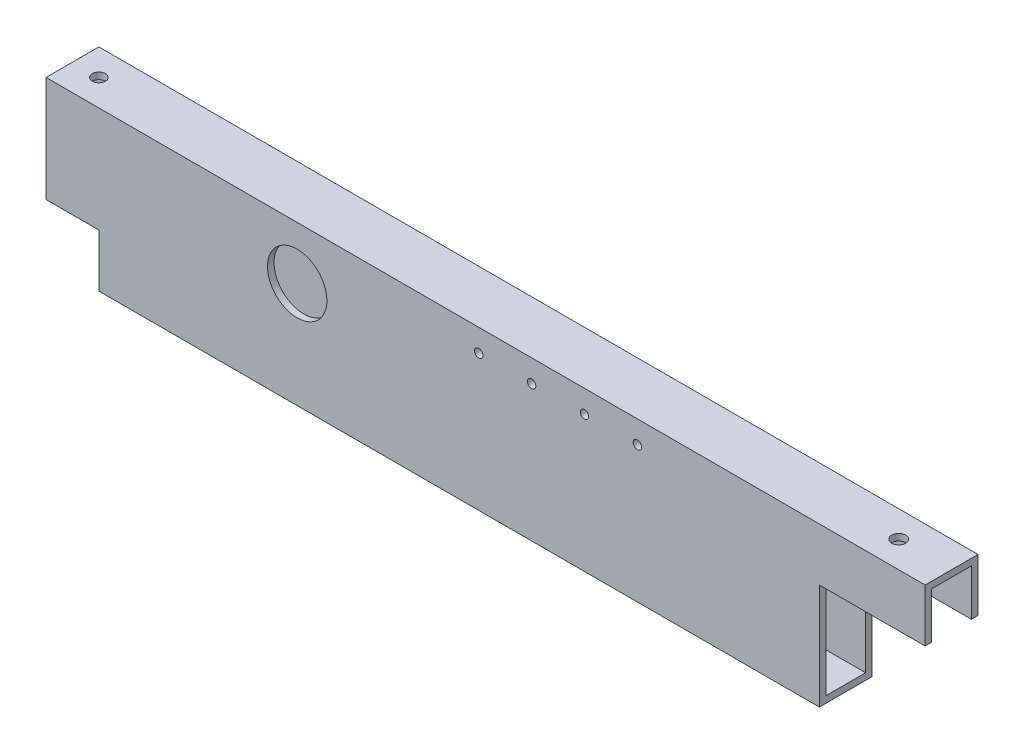
from build123d import *

# Parameters (mm, degrees)
BOSS_EXTRUDE1_DEPTH         = 12.7
F_1_4_0_25_DIAMETER_HOLE1_D = 6.35
CUT_EXTRUDE1_DEPTH          = 580.243923145
SKETCH8_R                   = 14.2875
CUT_EXTRUDE2_DEPTH          = 293.531067795
F_10_32_TAPPED_HOLE1_D      = 4.0386
F_10_32_TAPPED_HOLE1_DEPTH  = 13.716
F_10_32_TAPPED_HOLE1_TIP    = 1.213317848
SKETCH11_W                  = 155.575
SKETCH11_H                  = 76.2
CUT_EXTRUDE3_DEPTH          = 293.531067795
SKETCH13_W                  = 50.8
SKETCH13_H                  = 50.8
CUT_EXTRUDE5_DEPTH          = 293.531067795
F_1_4_CLEARANCE_HOLE1_D     = 6.7564


with BuildPart() as part:
    # Sketch1 → Boss-Extrude1 (new, symmetric)
    with BuildSketch(Plane.XY):
        Polygon((-288.925, 38.1), (-288.925, -12.7), (-263.525, -12.7), (-263.525, -38.1), (263.525, -38.1), (263.525, -12.7), (288.925, -12.7), (288.925, 38.1), align=None)
    extrude(amount=BOSS_EXTRUDE1_DEPTH, both=True)

    # 1/4 (0.25) Diameter Hole1 (through all)
    with Locations(Plane(origin=(0, 38.1, 0), x_dir=(1, 0, 0), z_dir=(0, 1, 0))):
        with Locations((-276.225, 0), (276.225, 0)):
            Hole(F_1_4_0_25_DIAMETER_HOLE1_D / 2)

    # Sketch5 → Cut-Extrude1 (cut, through all)
    with BuildSketch(Plane(origin=(288.925, 0, 0), x_dir=(0, 0, -1), z_dir=(1, 0, 0))):
        Polygon((9.525, -12.7), (9.525, 34.925), (-9.525, 34.925), (-9.525, -12.7), (-9.525, -34.925), (9.525, -34.925), align=None)
    extrude(amount=-CUT_EXTRUDE1_DEPTH, mode=Mode.SUBTRACT)

    # Sketch8 → Cut-Extrude2 (cut, through all)
    with BuildSketch(Plane.XY.offset(12.7)):
        with Locations((-168.275, 12.7)):
            Circle(SKETCH8_R)
        with Locations((168.275, 12.7)):
            Circle(SKETCH8_R)
    extrude(amount=-CUT_EXTRUDE2_DEPTH, mode=Mode.SUBTRACT)

    # #10-32 Tapped Hole1
    with Locations(Plane.XY.offset(12.7)):
        with Locations((-81.06918, 27.311649002), (-55.66918, 27.311649002), (-30.26918, 27.311649002), (-4.86918, 27.311649002)):
            Hole(F_10_32_TAPPED_HOLE1_D / 2, depth=F_10_32_TAPPED_HOLE1_DEPTH)
            with Locations((0, 0, -(F_10_32_TAPPED_HOLE1_DEPTH + F_10_32_TAPPED_HOLE1_TIP / 2))):  # 118° drill point
                Cone(0, F_10_32_TAPPED_HOLE1_D / 2, F_10_32_TAPPED_HOLE1_TIP, mode=Mode.SUBTRACT)

    # Sketch11 → Cut-Extrude3 (cut, through all)
    with BuildSketch(Plane.XY.offset(12.7)):
        with Locations((211.1375, 0)):
            Rectangle(SKETCH11_W, SKETCH11_H)
    extrude(amount=-CUT_EXTRUDE3_DEPTH, mode=Mode.SUBTRACT)

    # Sketch13 → Cut-Extrude5 (cut, through all)
    with BuildSketch(Plane.XY.offset(12.7)):
        with Locations((107.95, -12.7)):
            Rectangle(SKETCH13_W, SKETCH13_H)
    extrude(amount=-CUT_EXTRUDE5_DEPTH, mode=Mode.SUBTRACT)

    # 1/4 Clearance Hole1 (through all)
    with Locations(Plane(origin=(0, 38.1, 0), x_dir=(1, 0, 0), z_dir=(0, 1, 0))):
        with Locations((107.95, 0)):
            Hole(F_1_4_CLEARANCE_HOLE1_D / 2)


solid = part.part
